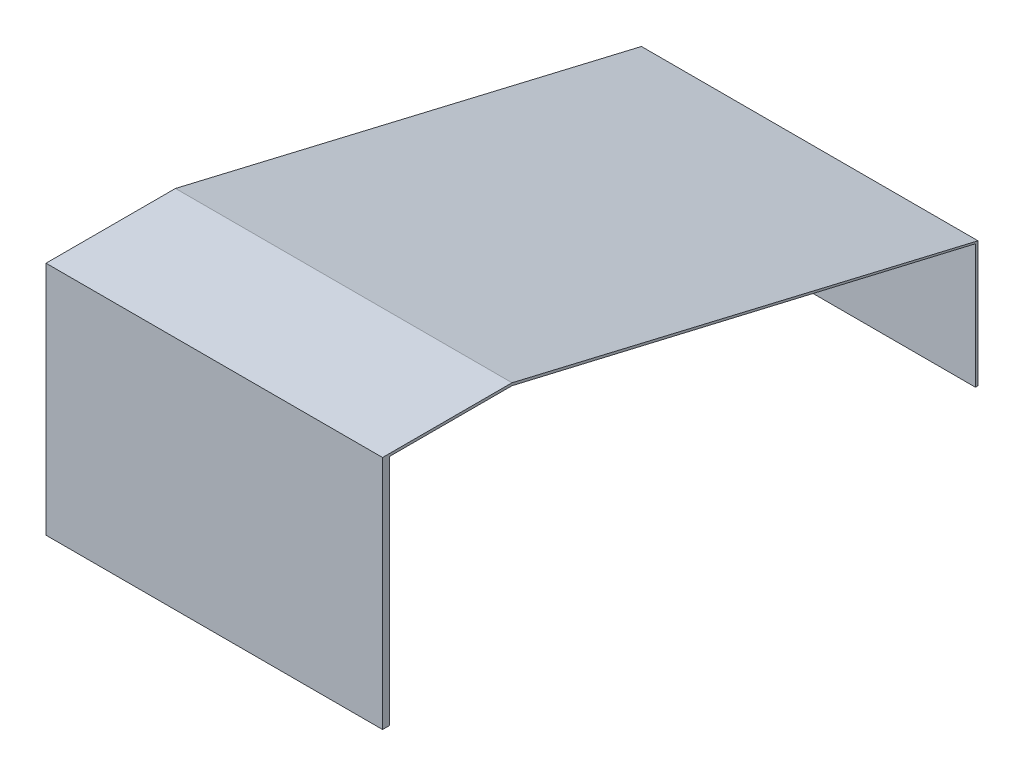
from build123d import *

# Parameters (mm, degrees)
SKETCH1_W           = 130
SKETCH1_H           = 190
BOSS_EXTRUDE1_DEPTH = 2
SKETCH2_W           = 130
SKETCH2_H           = 2.658683854
BOSS_EXTRUDE2_DEPTH = 78
SKETCH3_W           = 40
SKETCH3_H           = 2
BOSS_EXTRUDE3_DEPTH = 130
SKETCH5_W           = 130
SKETCH5_H           = 1
BOSS_EXTRUDE4_DEPTH = 90
SKETCH6_W           = 130
SKETCH6_H           = 230
BOSS_EXTRUDE5_DEPTH = 1
SKETCH7_W           = 130
SKETCH7_H           = 2.658683854
BOSS_EXTRUDE6_DEPTH = 13
SKETCH8_W           = 180
SKETCH8_H           = 43
BOSS_EXTRUDE7_DEPTH = 130
CHAMFER1_SIZE       = 42.5
CHAMFER1_SIZE2      = 180
CUT_EXTRUDE1_DEPTH  = 213.421692834
SKETCH11_W          = 130
SKETCH11_H          = 230
CUT_EXTRUDE6_DEPTH  = 2


with BuildPart() as part:
    # Sketch1 → Boss-Extrude1 (new body)
    with BuildSketch(Plane(origin=(0, 0, 0), x_dir=(1, 0, 0), z_dir=(0, 1, 0))):
        with Locations((19.070247934, -44.907024793)):
            Rectangle(SKETCH1_W, SKETCH1_H)
    extrude(amount=BOSS_EXTRUDE1_DEPTH)

    # Sketch2 → Boss-Extrude2 (add)
    with BuildSketch(Plane(origin=(0, 2, 0), x_dir=(1, 0, 0), z_dir=(0, 1, 0))):
        with Locations((19.070247934, -138.577682866)):
            Rectangle(SKETCH2_W, SKETCH2_H)
    extrude(amount=BOSS_EXTRUDE2_DEPTH)

    # Sketch3 → Boss-Extrude3 (add)
    with BuildSketch(Plane(origin=(84.070247934, 0, 0), x_dir=(0, 0, -1), z_dir=(1, 0, 0))):
        with Locations((70.092975207, 1)):
            Rectangle(SKETCH3_W, SKETCH3_H)
    extrude(amount=-BOSS_EXTRUDE3_DEPTH)

    # Sketch5 → Boss-Extrude4 (add)
    with BuildSketch(Plane(origin=(0, 2, 0), x_dir=(1, 0, 0), z_dir=(0, 1, 0))):
        with Locations((19.070247934, 89.592975207)):
            Rectangle(SKETCH5_W, SKETCH5_H)
    extrude(amount=BOSS_EXTRUDE4_DEPTH)

    # Sketch6 → Boss-Extrude5 (add)
    with BuildSketch(Plane(origin=(0, 92, 0), x_dir=(1, 0, 0), z_dir=(0, 1, 0))):
        with Locations((19.070247934, -24.907024793)):
            Rectangle(SKETCH6_W, SKETCH6_H)
    extrude(amount=BOSS_EXTRUDE5_DEPTH)

    # Sketch7 → Boss-Extrude6 (add)
    with BuildSketch(Plane(origin=(0, 80, 0), x_dir=(1, 0, 0), z_dir=(0, 1, 0))):
        with Locations((19.070247934, -138.577682866)):
            Rectangle(SKETCH7_W, SKETCH7_H)
    extrude(amount=BOSS_EXTRUDE6_DEPTH)

    # Sketch8 → Boss-Extrude7 (add)
    with BuildSketch(Plane.ZY.offset(45.929752066)):
        with Locations((-0.092975207, 71.5)):
            Rectangle(SKETCH8_W, SKETCH8_H)
    extrude(amount=-BOSS_EXTRUDE7_DEPTH)

    # Chamfer1
    chamfer1_edges = [part.edges().sort_by_distance(p)[0] for p in [
        (19.070247934, 93, -90.092975207),
    ]]
    chamfer1_side = [part.faces().sort_by_distance(p)[0] for p in [
        (19.070247934, 46.5, -90.092975207),
    ]]
    chamfer(chamfer1_edges, length=CHAMFER1_SIZE, length2=CHAMFER1_SIZE2, reference=chamfer1_side[0])

    # Sketch9 → Cut-Extrude1 (cut, through all)
    with BuildSketch(Plane.ZY.offset(45.929752066)):
        Polygon((89.907024793, 92), (-89.092975207, 50), (89.907024793, 50), align=None)
    extrude(amount=-CUT_EXTRUDE1_DEPTH, mode=Mode.SUBTRACT)

    # Sketch11 → Cut-Extrude6 (cut)
    with BuildSketch(Plane.XZ):
        with Locations((19.070247934, 24.907024793)):
            Rectangle(SKETCH11_W, SKETCH11_H)
    extrude(amount=-CUT_EXTRUDE6_DEPTH, mode=Mode.SUBTRACT)


solid = part.part
